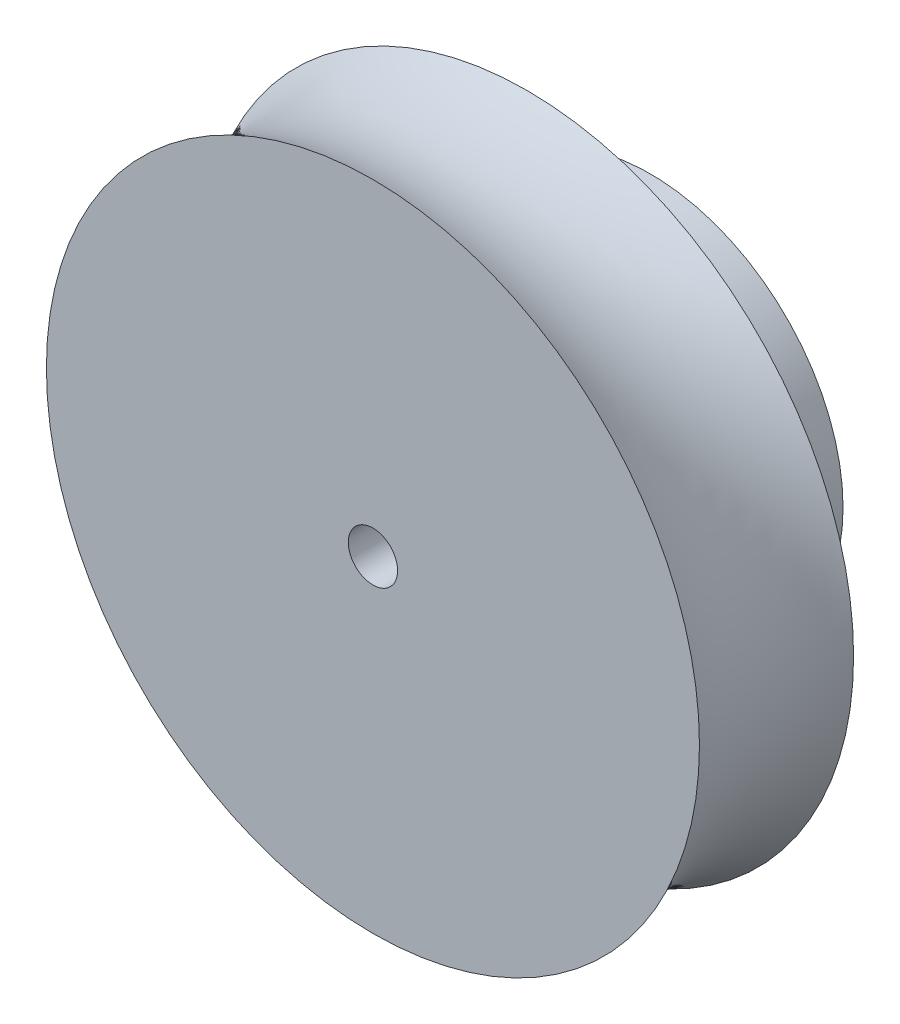
from build123d import *

# Parameters (mm, degrees)
SKETCH3_R               = 1.6
CUT_EXTRUDE1_DEPTH      = 32.583508329
SKETCH4_R               = 12.5
SKETCH4_R_2             = 1.75
BOSS_EXTRUDE1_DEPTH     = 8
CUT_EXTRUDE2_DEPTH      = 33.657587148
CUT_EXTRUDE2_DEPTH_BACK = 33.657587148
SKETCH5_R               = 1.65
CUT_EXTRUDE3_DEPTH      = 2.7
CUT_EXTRUDE4_DEPTH      = 2.7


with BuildPart() as part:
    # Sketch2 → Revolve1 (revolve)
    with BuildSketch(Plane(origin=(0, 0, 0), x_dir=(1, 0, 0), z_dir=(0, 1, 0))):
        with BuildLine():
            Line((0, 5), (0, -5))
            Line((0, -5), (21.183932571, -5))
            ThreePointArc((21.183932571, -5), (20, 0), (21.183932571, 5))
            Line((21.183932571, 5), (0, 5))
        make_face()
    revolve(axis=Axis((0, 0, -5), (0, 0, 1)))

    # Sketch3 → Cut-Extrude1 (cut, through all)
    with BuildSketch(Plane(origin=(0, 0, -5), x_dir=(-1, 0, 0), z_dir=(0, 0, -1))):
        Circle(SKETCH3_R)
    extrude(amount=-CUT_EXTRUDE1_DEPTH, mode=Mode.SUBTRACT)

    # Sketch4 → Boss-Extrude1 (add)
    with BuildSketch(Plane(origin=(0, 0, -5), x_dir=(-1, 0, 0), z_dir=(0, 0, -1))):
        Circle(SKETCH4_R)
        Circle(SKETCH4_R_2, mode=Mode.SUBTRACT)
    extrude(amount=BOSS_EXTRUDE1_DEPTH)

    # Sketch5 → Cut-Extrude2 (cut, two sides: drawn at the far end of the back side and taken through both)
    with BuildSketch(Plane(origin=(0, 0, 0), x_dir=(0, 0, -1), z_dir=(1, 0, 0)).offset(-CUT_EXTRUDE2_DEPTH_BACK)):
        with Locations((9, 0)):
            Circle(SKETCH5_R)
    extrude(amount=CUT_EXTRUDE2_DEPTH + CUT_EXTRUDE2_DEPTH_BACK, mode=Mode.SUBTRACT)

    # Sketch6 → Cut-Extrude3 (cut)
    with BuildSketch(Plane(origin=(-3.2, 0, 0), x_dir=(0, 0, -1), z_dir=(1, 0, 0))):
        Polygon((10.645448267, 2.85), (13, 2.85), (13, -2.85), (10.645448267, -2.85), (7.354551733, -2.85), (5.709103466, 0), (7.354551733, 2.85), align=None)
    extrude(amount=-CUT_EXTRUDE3_DEPTH, mode=Mode.SUBTRACT)

    # Sketch7 → Cut-Extrude4 (cut)
    with BuildSketch(Plane(origin=(3.2, 0, 0), x_dir=(0, 0, -1), z_dir=(1, 0, 0))):
        Polygon((13, 2.85), (10.645448267, 2.85), (7.354551733, 2.85), (5.709103466, 0), (7.354551733, -2.85), (10.645448267, -2.85), (13, -2.85), align=None)
    extrude(amount=CUT_EXTRUDE4_DEPTH, mode=Mode.SUBTRACT)


solid = part.part
